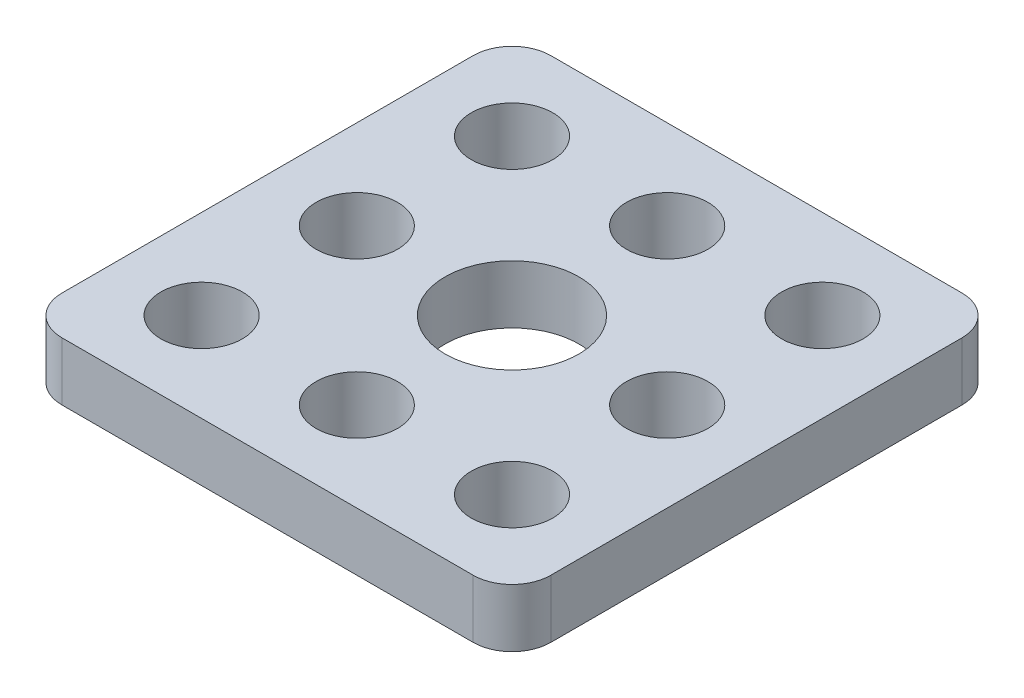
from build123d import *

# Parameters (mm, degrees)
SKETCH1_W           = 25.2
SKETCH1_H           = 25.2
SKETCH1_R           = 2.1
SKETCH1_R_2         = 3.45
BOSS_EXTRUDE1_DEPTH = 3
FILLET1_R           = 2


with BuildPart() as part:
    # Sketch1 → Boss-Extrude1 (new body)
    with BuildSketch(Plane(origin=(0, 0, 0), x_dir=(1, 0, 0), z_dir=(0, 1, 0))):
        with Locations((12.6, 12.6)):
            Rectangle(SKETCH1_W, SKETCH1_H)
        with Locations((4.6, 4.6)):
            Circle(SKETCH1_R, mode=Mode.SUBTRACT)
        with Locations((12.6, 4.6)):
            Circle(SKETCH1_R, mode=Mode.SUBTRACT)
        with Locations((20.6, 4.6)):
            Circle(SKETCH1_R, mode=Mode.SUBTRACT)
        with Locations((4.6, 12.6)):
            Circle(SKETCH1_R, mode=Mode.SUBTRACT)
        with Locations((4.6, 20.6)):
            Circle(SKETCH1_R, mode=Mode.SUBTRACT)
        with Locations((20.6, 12.6)):
            Circle(SKETCH1_R, mode=Mode.SUBTRACT)
        with Locations((20.6, 20.6)):
            Circle(SKETCH1_R, mode=Mode.SUBTRACT)
        with Locations((12.6, 20.6)):
            Circle(SKETCH1_R, mode=Mode.SUBTRACT)
        with Locations((12.6, 12.6)):
            Circle(SKETCH1_R_2, mode=Mode.SUBTRACT)
    extrude(amount=BOSS_EXTRUDE1_DEPTH)

    # Fillet1
    fillet1_edges = [part.edges().sort_by_distance(p)[0] for p in [
        (25.2, 1.5, 0),
        (0, 1.5, 0),
        (0, 1.5, -25.2),
        (25.2, 1.5, -25.2),
    ]]
    fillet(fillet1_edges, radius=FILLET1_R)


solid = part.part
